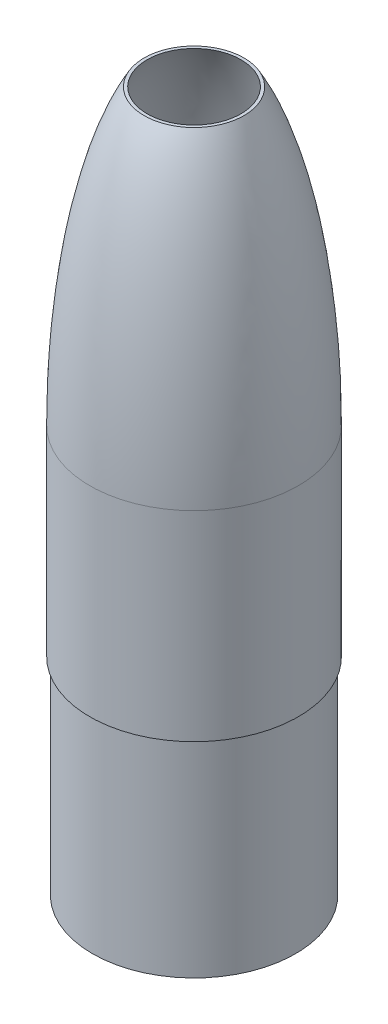
from build123d import *

# Parameters (mm, degrees)
BOSS_EXTRUDE1_START = -304.8
SKETCH2_R           = 76.2
SKETCH2_R_2         = 74.2
BOSS_EXTRUDE1_DEPTH = 304.8
SKETCH3_R           = 102.13398709
CUT_EXTRUDE1_DEPTH  = 30


with BuildPart() as part:
    # Sketch1 → Revolve1 (revolve)
    with BuildSketch(Plane.XY):
        with BuildLine():
            Line((76.2, 150), (76.2, 0))
            Line((76.2, 0), (78.16, 0))
            Line((78.16, 0), (78.16, 150))
            add(Edge.make_bspline(
                [(0, 400), (2.723149784, 400), (8.095363208, 399.131102803), (15.985209364, 395.313409978), (23.550682528, 389.130576689), (33.207143777, 377.875372886), (44.403572502, 358.368758892), (56.109342912, 327.087146412), (65.689764926, 289.080732548), (71.61438571, 252.993821619), (74.98797824, 222.299614595), (76.812690029, 198.58573428), (77.914396428, 174.415956203), (78.16, 158.124741441), (78.16, 150)],
                knots=[-1.570796327, -1.570796327, -1.570796327, -1.570796327, -1.472621556, -1.374446786, -1.276272016, -1.178097245, -0.981747704, -0.785398163, -0.589048623, -0.392699082, -0.294524311, -0.196349541, -0.09817477, 0, 0, 0, 0], degree=3))
            Line((0, 400), (0, 398.04))
            add(Edge.make_bspline(
                [(76.2, 150), (76.2, 398.04), (0, 398.04)],
                knots=[4.71238898, 4.71238898, 4.71238898, 6.283185307, 6.283185307, 6.283185307], degree=2, weights=[1, 0.707106781, 1]))
        make_face()
    revolve(axis=Axis((0, 0, 0), (0, 1, 0)))

    # Sketch2 → Boss-Extrude1 (add)
    with BuildSketch(Plane(origin=(0, 150, 0), x_dir=(1, 0, 0), z_dir=(0, 1, 0)).offset(BOSS_EXTRUDE1_START)):
        Circle(SKETCH2_R)
        Circle(SKETCH2_R_2, mode=Mode.SUBTRACT)
    extrude(amount=BOSS_EXTRUDE1_DEPTH)

    # Sketch3 → Cut-Extrude1 (cut)
    with BuildSketch(Plane(origin=(0, 400, 0), x_dir=(-1, 0, 0), z_dir=(0, -1, 0))):
        Circle(SKETCH3_R)
    extrude(amount=CUT_EXTRUDE1_DEPTH, mode=Mode.SUBTRACT)


solid = part.part
